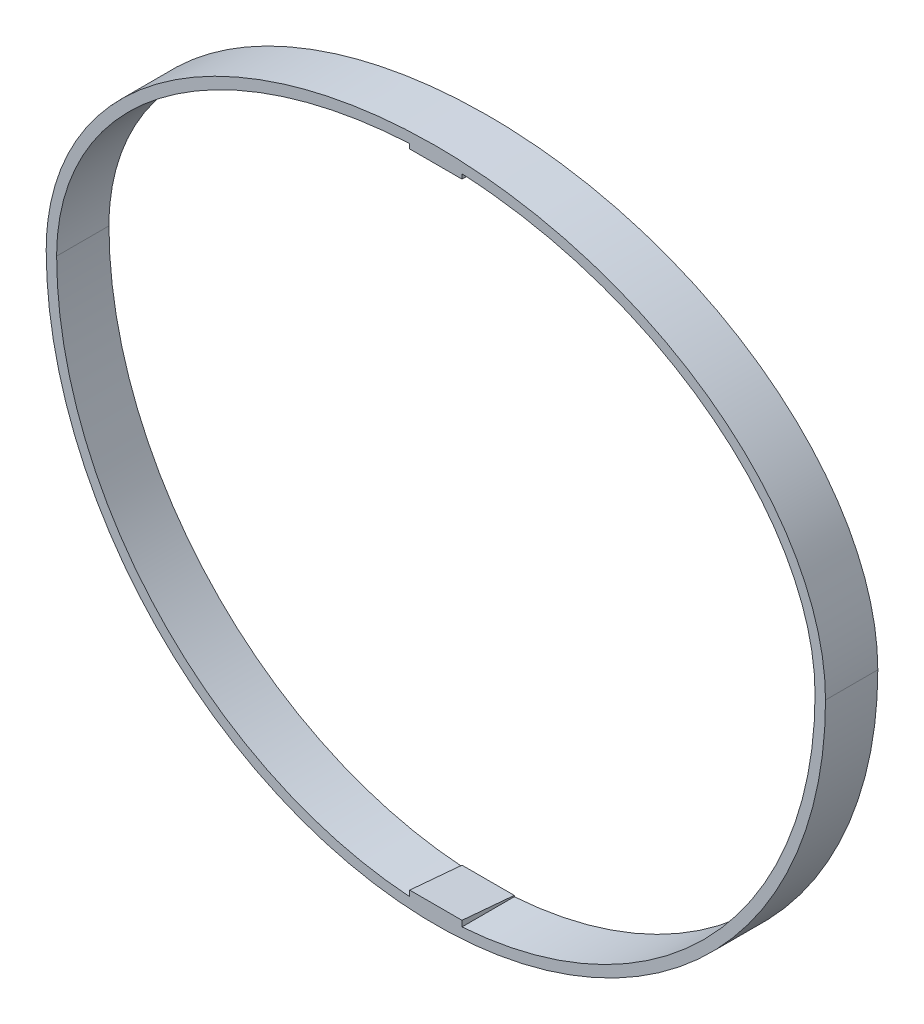
from build123d import *

# Parameters (mm, degrees)
EXTRUDE_THIN4_DEPTH  = 12.7
BOSS_EXTRUDE4_START  = -1.285403
SKETCH9_W            = 12.7
SKETCH9_H            = 12.7
BOSS_EXTRUDE4_DEPTH  = 1.285403
SKETCH18_W           = 12.7
SKETCH18_H           = 12.7
BOSS_EXTRUDE11_DEPTH = 0.508
BOSS_EXTRUDE12_DEPTH = 12.7


# Read off the part's stored shape, not the designer's step: Extrude-Thin4
with BuildPart() as part:
    # Extrude-Thin4 outline → Extrude-Thin4 (new body)
    with BuildSketch(Plane.XY):
        with BuildLine():
            ThreePointArc((-94.615, 0), (0, -94.615), (94.615, 0))
            add(Edge.make_bspline(
                [(94.615, 0), (94.615, 2.73261432), (94.395490525, 5.426625193), (93.54401895, 10.742112058), (92.911931877, 13.363566074), (91.660435042, 17.242396406), (91.191270419, 18.528568166), (90.168762341, 21.043712381), (89.614022449, 22.277697693), (87.826365425, 25.912701016), (86.470442882, 28.247000696), (84.585863218, 31.06199447), (84.199428542, 31.619830243), (83.407778518, 32.725315123), (83.001887397, 33.273825859), (81.762898011, 34.895827175), (80.90808464, 35.946702496), (78.263231539, 39.014343992), (76.393087657, 40.946452093), (72.461804782, 44.60881511), (70.400552775, 46.338950587), (67.175816993, 48.793743065), (66.078704621, 49.588544685), (63.841229223, 51.13243847), (62.707886547, 51.876655554), (59.272732326, 54.027034208), (56.933188029, 55.353065789), (52.164586894, 57.810404839), (49.735490844, 58.941627007), (44.793689995, 61.022190247), (42.280964323, 61.97148591), (38.451744208, 63.264620094), (37.165298005, 63.673825065), (34.572564534, 64.449073075), (33.26500114, 64.81537478), (26.721531086, 66.528934319), (21.437450815, 67.535478954), (10.778679303, 68.879054675), (5.403934101, 69.215687043), (-2.726662378, 69.214654911), (-5.424789063, 69.129445108), (-10.790309058, 68.792778457), (-13.458884287, 68.541316332), (-21.421997842, 67.537204644), (-26.674282833, 66.536932479), (-34.461856375, 64.504081304), (-37.042489287, 63.737239618), (-40.888891672, 62.443121275), (-42.169219974, 61.986801748), (-44.70335009, 61.030836829), (-45.958505365, 60.530833267), (-52.173703529, 57.918806786), (-56.954079496, 55.474581033), (-63.79472601, 51.198227458), (-66.019580064, 49.670413346), (-69.263545781, 47.206152749), (-70.327786152, 46.356755825), (-72.401450601, 44.615309625), (-73.413550097, 43.721273672), (-76.37310693, 40.9668298), (-78.244137425, 39.034382611), (-81.76209758, 34.95825275), (-83.409211697, 32.814743947), (-85.687772675, 29.418399352), (-86.408457843, 28.265769226), (-87.766179903, 25.925109257), (-88.403920063, 24.736041385), (-90.190013765, 21.110908862), (-91.211831115, 18.617184418), (-92.257768409, 15.394614809), (-92.455342881, 14.744809102), (-92.826557707, 13.43429143), (-93.000389748, 12.772621628), (-93.481472485, 10.785340575), (-93.749581467, 9.453635256), (-94.395330303, 5.437869137), (-94.615, 2.733237345), (-94.615, 0)],
                knots=[0, 0, 0, 0, 0.03125, 0.03125, 0.0625, 0.0625, 0.078125, 0.078125, 0.09375, 0.09375, 0.125, 0.125, 0.1328125, 0.1328125, 0.140625, 0.140625, 0.15625, 0.15625, 0.1875, 0.1875, 0.21875, 0.21875, 0.234375, 0.234375, 0.25, 0.25, 0.28125, 0.28125, 0.3125, 0.3125, 0.34375, 0.34375, 0.359375, 0.359375, 0.375, 0.375, 0.4375, 0.4375, 0.5, 0.5, 0.53125, 0.53125, 0.5625, 0.5625, 0.625, 0.625, 0.65625, 0.65625, 0.671875, 0.671875, 0.6875, 0.6875, 0.75, 0.75, 0.78125, 0.78125, 0.796875, 0.796875, 0.8125, 0.8125, 0.84375, 0.84375, 0.875, 0.875, 0.890625, 0.890625, 0.90625, 0.90625, 0.9375, 0.9375, 0.9453125, 0.9453125, 0.953125, 0.953125, 0.96875, 0.96875, 1, 1, 1, 1], degree=3))
        make_face()
        with BuildLine():
            add(Edge.make_bspline(
                [(92.075, 0), (92.075, 66.675), (0, 66.675), (-92.075, 66.675), (-92.075, 0)],
                knots=[0, 0, 0, 1.570796327, 1.570796327, 3.141592654, 3.141592654, 3.141592654], degree=2, weights=[1, 0.707106781, 1, 0.707106781, 1]))
            ThreePointArc((92.075, 0), (0, -92.075), (-92.075, 0))
        make_face(mode=Mode.SUBTRACT)
    extrude(amount=EXTRUDE_THIN4_DEPTH)

    # Sketch9 → Boss-Extrude4 (add)
    with BuildSketch(Plane(origin=(-6.3332e-05, 66.675, 0), x_dir=(0.999999999999549, 9.498577862699883e-07, 0), z_dir=(-9.498577862699883e-07, 0.999999999999549, 0)).offset(BOSS_EXTRUDE4_START)):
        with Locations((0, -6.35)):
            Rectangle(SKETCH9_W, SKETCH9_H)
    extrude(amount=BOSS_EXTRUDE4_DEPTH)

    # Sketch18 → Boss-Extrude11 (add)
    with BuildSketch(Plane(origin=(0, -92.075, 0), x_dir=(-1, 0, 0), z_dir=(0, -1, 0))):
        with Locations((0, -6.35)):
            Rectangle(SKETCH18_W, SKETCH18_H)
    extrude(amount=-BOSS_EXTRUDE11_DEPTH)

    # Sketch19 → Boss-Extrude12 (add)
    with BuildSketch(Plane(origin=(6.35, 0, 0), x_dir=(0, 0, -1), z_dir=(1, 0, 0))):
        Polygon((-12.7, -91.567), (-12.7, -90.455893973), (0, -91.567), align=None)
    extrude(amount=-BOSS_EXTRUDE12_DEPTH)


solid = part.part
